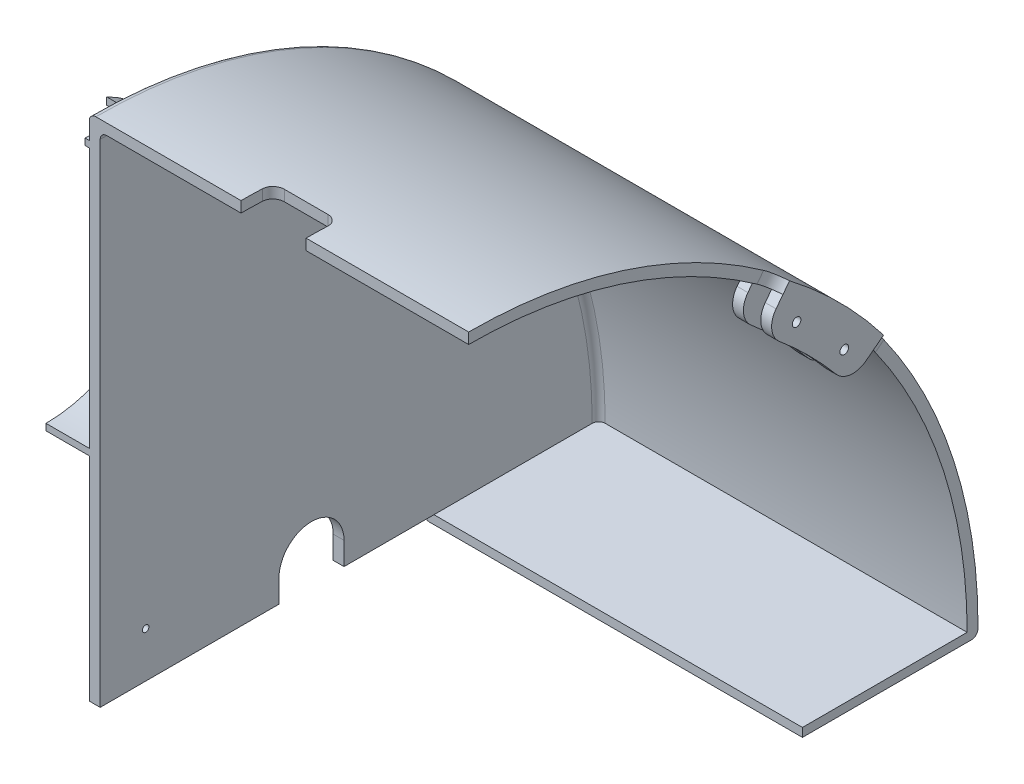
from build123d import *

# Parameters (mm, degrees)
SKETCH_1_R          = 235
EXTRUDE_1_DEPTH     = 5
SKETCH_2_R          = 235
SKETCH_2_R_2        = 230
EXTRUDE_2_DEPTH     = 170
CUT_EXTRUDE_1_DEPTH = 376.599520766
EXTRUDE_START       = -5
EXTRUDE_3_DEPTH     = 5
EXTRUDE_4_DEPTH     = 5
SKETCH_6_R          = 2
CUT_EXTRUDE_2_DEPTH = 5
FILLET_1_R          = 3
EXTRUDE_5_DEPTH     = 5
FILLET_2_R          = 10
FILLET_3_R          = 10
SKETCH_8_R          = 2
CUT_EXTRUDE_3_DEPTH = 5
FILLET_4_R          = 10
EXTRUDE_6_DEPTH     = 4
FILLET_5_R          = 3
EXTRUDE_7_DEPTH     = 20
CUT_EXTRUDE_START   = 120
SKETCH_12_W         = 22.896395415
SKETCH_12_H         = 51.404652451
CUT_EXTRUDE_5_DEPTH = 120
SKETCH_13_W         = 30
SKETCH_13_H         = 30
CUT_EXTRUDE_6_DEPTH = 378.955023951
FILLET_6_R          = 5
CUT_EXTRUDE_7_DEPTH = 10
SKETCH_15_R         = 1.5
CUT_EXTRUDE_8_DEPTH = 10
CHAMFER_1_SIZE      = 0.5
SKETCH_16_R         = 2
CUT_EXTRUDE_9_DEPTH = 10
CHAMFER_2_SIZE      = 0.5


with BuildPart() as part:
    # 草图1 → 凸台-拉伸1 (new body)
    with BuildSketch(Plane(origin=(0, 0, 0), x_dir=(0, 0, -1), z_dir=(1, 0, 0))):
        Circle(SKETCH_1_R)
    extrude(amount=EXTRUDE_1_DEPTH)

    # 草图2 → 凸台-拉伸2 (add)
    with BuildSketch(Plane(origin=(5, 0, 0), x_dir=(0, 0, -1), z_dir=(1, 0, 0))):
        Circle(SKETCH_2_R)
        Circle(SKETCH_2_R_2, mode=Mode.SUBTRACT)
    extrude(amount=EXTRUDE_2_DEPTH)

    # 草图3 → 切除-拉伸1 (cut, through all)
    with BuildSketch(Plane.ZY):
        Polygon((0, 0), (0, 250), (330.887429436, 250), (330.887429436, -253.432712339), (-250, -253.432712339), (-250, 0), align=None)
    extrude(amount=-CUT_EXTRUDE_1_DEPTH, mode=Mode.SUBTRACT)

    # 草图4 → 凸台-拉伸3 (add)
    with BuildSketch(Plane(origin=(167, 0, 0), x_dir=(0, 0, -1), z_dir=(1, 0, 0)).offset(EXTRUDE_START)):
        with BuildLine():
            Line((170.570968163, 130.883707237), (182.471268267, 140.015128672))
            ThreePointArc((182.471268267, 140.015128672), (162.634559673, 162.634559673), (140.015128672, 182.471268267))
            Line((140.015128672, 182.471268267), (130.883707237, 170.570968163))
            ThreePointArc((130.883707237, 170.570968163), (152.027957955, 152.027957955), (170.570968163, 130.883707237))
        make_face()
    extrude(amount=EXTRUDE_3_DEPTH)

    # 草图5 → 凸台-拉伸4 (add)
    with BuildSketch(Plane(origin=(59, 0, 0), x_dir=(0, 0, -1), z_dir=(1, 0, 0)).offset(EXTRUDE_START)):
        with BuildLine():
            Line((170.570968163, 130.883707237), (182.471268267, 140.015128672))
            ThreePointArc((182.471268267, 140.015128672), (162.634559673, 162.634559673), (140.015128672, 182.471268267))
            Line((140.015128672, 182.471268267), (130.883707237, 170.570968163))
            ThreePointArc((130.883707237, 170.570968163), (152.027957955, 152.027957955), (170.570968163, 130.883707237))
        make_face()
    extrude(amount=EXTRUDE_4_DEPTH)

    # 草图6 → 切除-拉伸2 (cut)
    with BuildSketch(Plane(origin=(167, 0, 0), x_dir=(0, 0, -1), z_dir=(1, 0, 0))):
        with Locations((146.301163465, 168.30023639)):
            Circle(SKETCH_6_R)
        with Locations((168.30023639, 146.301163465)):
            Circle(SKETCH_6_R)
    extrude(amount=-CUT_EXTRUDE_2_DEPTH, mode=Mode.SUBTRACT)

    # 圆角1
    fillet_1_edges = [part.edges().sort_by_distance(p)[0] for p in [
        (5, 162.634559673, -162.634559673),
        (0, 166.170093579, -166.170093579),
    ]]
    fillet(fillet_1_edges, radius=FILLET_1_R)

    # 草图7 → 凸台-拉伸5 (add)
    with BuildSketch(Plane(origin=(175, 0, 0), x_dir=(0, 0, -1), z_dir=(1, 0, 0))):
        with BuildLine():
            Line((170.570968163, 130.883707237), (186.438034968, 143.058935817))
            ThreePointArc((186.438034968, 143.058935817), (166.170093579, 166.170093579), (143.058935817, 186.438034968))
            Line((143.058935817, 186.438034968), (130.883707237, 170.570968163))
            ThreePointArc((130.883707237, 170.570968163), (152.027957955, 152.027957955), (170.570968163, 130.883707237))
        make_face()
    extrude(amount=EXTRUDE_5_DEPTH)

    # 圆角2
    # the kernel refuses this fillet: 10 mm, written as the material it adds along each edge
    with BuildSketch(Plane(origin=(175, 203.61463864, -156.239007376), x_dir=(0, 0.6087614290087151, 0.7933533402912394), z_dir=(0, -0.7933533402912395, 0.6087614290087151))) as fillet_2_piece_1_section:
        with BuildLine():
            CenterArc((8.660254038, -10), FILLET_2_R, 90, 60)
            Line((0, -5), (0, 0))
            Line((0, 0), (8.660254038, 0))
        make_face()
    fillet_2_piece_1 = extrude(amount=48.301270189, mode=Mode.PRIVATE)
    fillet_2_piece_1 = fillet_2_piece_1 & Plane(origin=(176.322425454, 0, 0), x_dir=(0, 0, -1), z_dir=(-1, 0, 0)) * Cylinder(235, 132, mode=Mode.PRIVATE)
    fillet_2_piece_1 = fillet_2_piece_1 - Plane(origin=(176.322425454, 0, 0), x_dir=(0, 0, -1), z_dir=(-1, 0, 0)) * Cylinder(230, 132, mode=Mode.PRIVATE)
    add(fillet_2_piece_1)
    with BuildSketch(Plane(origin=(175, 126.835057113, -165.294664595), x_dir=(0, -0.7933533402912374, -0.6087614290087175), z_dir=(0, 0.6087614290087178, -0.7933533402912375))) as fillet_2_piece_2_section:
        with BuildLine():
            CenterArc((8.660254038, -10), FILLET_2_R, 90, 60)
            Line((0, -5), (0, 0))
            Line((0, 0), (8.660254038, 0))
        make_face()
    fillet_2_piece_2 = extrude(amount=48.301270189, mode=Mode.PRIVATE)
    fillet_2_piece_2 = fillet_2_piece_2 & Plane(origin=(176.322425454, 0, 0), x_dir=(0, 0, -1), z_dir=(-1, 0, 0)) * Cylinder(235, 132, mode=Mode.PRIVATE)
    fillet_2_piece_2 = fillet_2_piece_2 - Plane(origin=(176.322425454, 0, 0), x_dir=(0, 0, -1), z_dir=(-1, 0, 0)) * Cylinder(230, 132, mode=Mode.PRIVATE)
    add(fillet_2_piece_2)

    # 圆角3
    fillet_3_edges = [part.edges().sort_by_distance(p)[0] for p in [
        (164.5, 130.883707237, -170.570968163),
        (164.5, 170.570968163, -130.883707237),
        (177.5, 170.570968163, -130.883707237),
        (177.5, 130.883707237, -170.570968163),
    ]]
    fillet(fillet_3_edges, radius=FILLET_3_R)

    # 草图8 → 切除-拉伸3 (cut)
    with BuildSketch(Plane(origin=(180, 0, 0), x_dir=(0, 0, -1), z_dir=(1, 0, 0))):
        with Locations((168.30023639, 146.301163465)):
            Circle(SKETCH_8_R)
        with Locations((146.301163465, 168.30023639)):
            Circle(SKETCH_8_R)
    extrude(amount=-CUT_EXTRUDE_3_DEPTH, mode=Mode.SUBTRACT)

    # 圆角4
    fillet_4_edges = [part.edges().sort_by_distance(p)[0] for p in [
        (56.5, 130.883707237, -170.570968163),
        (56.5, 170.570968163, -130.883707237),
    ]]
    fillet(fillet_4_edges, radius=FILLET_4_R)

    # 草图10 → 凸台-拉伸6 (add)
    with BuildSketch(Plane.XZ):
        with BuildLine():
            Line((0, -154), (0, -232))
            ThreePointArc((0, -232), (0.878679656, -234.121320344), (3, -235))
            Line((3, -235), (175, -235))
            Line((175, -235), (175, -154))
            Line((175, -154), (0, -154))
        make_face()
    extrude(amount=EXTRUDE_6_DEPTH)

    # 圆角5
    fillet_5_edges = [part.edges().sort_by_distance(p)[0] for p in [
        (0.878679656, -4, -234.121320344),
        (89, -4, -235),
        (0, -4, -193),
    ]]
    fillet(fillet_5_edges, radius=FILLET_5_R)

    # 草图11 → 凸台-拉伸7 (add)
    with BuildSketch(Plane.ZY):
        with BuildLine():
            Line((0, 224), (0, 221))
            ThreePointArc((0, 221), (-24.121230247, 215.937839886), (-44.172276172, 201.605541713))
            Line((-44.172276172, 201.605541713), (-46.2953836, 203.72864914))
            ThreePointArc((-46.2953836, 203.72864914), (-25.269498453, 218.710072326), (0, 224))
        make_face()
        with BuildLine():
            Line((0, 98), (0, 101))
            ThreePointArc((0, 101), (-24.121230247, 106.062160114), (-44.172276172, 120.394458287))
            Line((-44.172276172, 120.394458287), (-46.2953836, 118.27135086))
            ThreePointArc((-46.2953836, 118.27135086), (-25.269498453, 103.289927674), (0, 98))
        make_face()
        with BuildLine():
            Line((-50.754310162, 129), (-53.214501999, 127.27735513))
            ThreePointArc((-53.214501999, 127.27735513), (-63, 161), (-53.214501999, 194.72264487))
            Line((-53.214501999, 194.72264487), (-50.754310162, 193))
            ThreePointArc((-50.754310162, 193), (-60, 161), (-50.754310162, 129))
        make_face()
    extrude(amount=EXTRUDE_7_DEPTH)

    # 草图12 → 切除-拉伸5 (cut)
    with BuildSketch(Plane(origin=(0, 0, 0), x_dir=(1, 0, 0), z_dir=(0, 1, 0)).offset(CUT_EXTRUDE_START)):
        with Locations((-13.448197708, 2.297673774)):
            Rectangle(SKETCH_12_W, SKETCH_12_H)
    extrude(amount=CUT_EXTRUDE_5_DEPTH, mode=Mode.SUBTRACT)

    # 草图13 → 切除-拉伸6 (cut, through all)
    with BuildSketch(Plane(origin=(0, 0, 0), x_dir=(1, 0, 0), z_dir=(0, 1, 0))):
        with Locations((85, 0)):
            Rectangle(SKETCH_13_W, SKETCH_13_H)
    extrude(amount=CUT_EXTRUDE_6_DEPTH, mode=Mode.SUBTRACT)

    # 圆角6
    fillet_6_edges = [part.edges().sort_by_distance(p)[0] for p in [
        (70, 232.015568171, -15),
        (100, 232.015568171, -15),
    ]]
    fillet(fillet_6_edges, radius=FILLET_6_R)

    # 草图14 → 切除-拉伸7 (cut)
    with BuildSketch(Plane.ZY):
        with BuildLine():
            Line((-82.5, 10.5), (-82.5, 0))
            Line((-82.5, 0), (-112.5, 0))
            Line((-112.5, 0), (-112.5, 10.5))
            ThreePointArc((-112.5, 10.5), (-97.5, 25.5), (-82.5, 10.5))
        make_face()
    extrude(amount=-CUT_EXTRUDE_7_DEPTH, mode=Mode.SUBTRACT)

    # 草图15 → 切除-拉伸8 (cut)
    with BuildSketch(Plane.ZY):
        with Locations((-21, 21)):
            Circle(SKETCH_15_R)
    extrude(amount=-CUT_EXTRUDE_8_DEPTH, mode=Mode.SUBTRACT)

    # 倒角1
    chamfer_1_edges = [part.edges().sort_by_distance(p)[0] for p in [
        (0, 21, -22.5),
    ]]
    chamfer(chamfer_1_edges, length=CHAMFER_1_SIZE)

    # 草图16 → 切除-拉伸9 (cut)
    with BuildSketch(Plane.ZY):
        with Locations((-159.099025767, 137.885822331)):
            Circle(SKETCH_16_R)
        with Locations((-137.885822331, 159.099025767)):
            Circle(SKETCH_16_R)
    extrude(amount=-CUT_EXTRUDE_9_DEPTH, mode=Mode.SUBTRACT)

    # 倒角2
    chamfer_2_edges = [part.edges().sort_by_distance(p)[0] for p in [
        (0, 137.885822331, -161.099025767),
        (0, 159.099025767, -139.885822331),
    ]]
    chamfer(chamfer_2_edges, length=CHAMFER_2_SIZE)


solid = part.part
